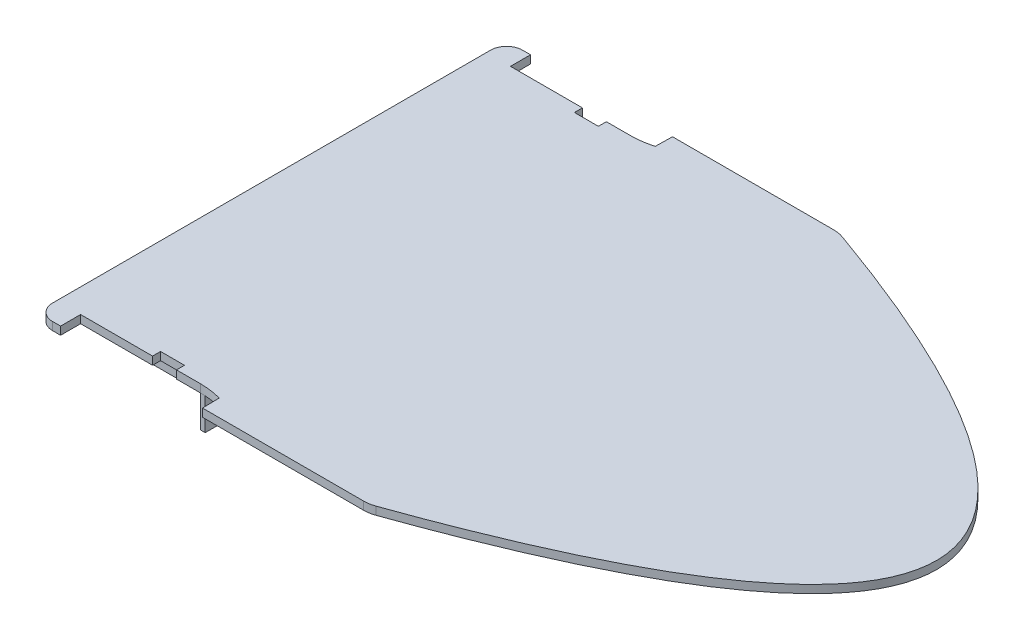
from build123d import *

# Parameters (mm, degrees)
CROQUIS1_W                 = 416
CROQUIS1_H                 = 294
SALIENTE_EXTRUIR1_DEPTH    = 5
CORTAR_EXTRUIR1_DEPTH      = 255.750858684
REDONDEO1_R                = 10
SALIENTE_EXTRUIR3_DEPTH    = 20
REDONDEO2_R                = 5
REDONDEO2_OF_SIMETR_A3_R   = 5
CORTAR_EXTRUIR5_DEPTH      = 256.925770488
CORTAR_EXTRUIR5_DEPTH_BACK = 256.925770488
REDONDEO4_R                = 20
ESCALA1_START              = -20
ESCALA1_DEPTH              = 17.828103166
ESCALA1_START_2            = -2.171896834
ESCALA1_2_DEPTH            = 10
ESCALA1_START_3            = -42.171896834
ESCALA1_3_DEPTH            = 40
CROQUIS9_W                 = 50
CROQUIS9_H                 = 50
SALIENTE_EXTRUIR4_DEPTH    = 2
REDONDEO5_R                = 5
CROQUIS10_R                = 2
CORTAR_EXTRUIR7_DEPTH      = 2
CROQUIS11_R                = 20
SALIENTE_EXTRUIR5_DEPTH    = 3
CROQUIS12_R                = 16
CORTAR_EXTRUIR8_DEPTH      = 3
CROQUIS13_R                = 20
SALIENTE_EXTRUIR6_DEPTH    = 2
CROQUIS14_R                = 18
CORTAR_EXTRUIR9_DEPTH      = 2


# Read off the part's stored shape, not the designer's step: Escala1
with BuildPart() as part:
    # Croquis1 → Saliente-Extruir1 (new body)
    with BuildSketch(Plane(origin=(0, 0, 0), x_dir=(1, 0, 0), z_dir=(0, 1, 0))):
        Rectangle(CROQUIS1_W, CROQUIS1_H)
    extrude(amount=SALIENTE_EXTRUIR1_DEPTH)

    # Croquis3 → Cortar-Extruir1 (cut, through all)
    with BuildSketch(Plane(origin=(0, 5, 0), x_dir=(1, 0, 0), z_dir=(0, 1, 0))):
        with BuildLine():
            Line((-193, 154.47), (-193, 134.47))
            Line((-193, 134.47), (-148, 134.47))
            Line((-148, 134.47), (-148, 129.47))
            Line((-148, 129.47), (-133, 129.47))
            Line((-133, 129.47), (-133, 134.47))
            Line((-133, 134.47), (-118, 134.47))
            ThreePointArc((-118, 134.47), (-111.127739024, 134.944531511), (-104.385922224, 136.359118837))
            Line((-104.385922224, 136.359118837), (-104, 156.355395091))
            Line((-104, 156.355395091), (-193, 156.355395091))
            Line((-193, 156.355395091), (-193, 154.47))
        make_face()
    cortar_extruir1 = extrude(amount=-CORTAR_EXTRUIR1_DEPTH, mode=Mode.SUBTRACT)

    # Simetría1: Cortar-Extruir1 across plane
    add(cortar_extruir1.mirror(Plane.XY), mode=Mode.SUBTRACT)

    # Redondeo1
    redondeo1_edges = [part.edges().sort_by_distance(p)[0] for p in [
        (-208, 2.5, -147),
        (208, 2.5, -147),
        (208, 2.5, 147),
        (-208, 2.5, 147),
    ]]
    fillet(redondeo1_edges, radius=REDONDEO1_R)

    # Croquis5 → Saliente-Extruir3 (add)
    with BuildSketch(Plane.XZ):
        Polygon((-208, 110.96), (-115, 110.96), (-115, 134.560081146), (-118, 134.47), (-118, 113.96), (-208, 113.96), align=None)
    saliente_extruir3 = extrude(amount=SALIENTE_EXTRUIR3_DEPTH)

    # Redondeo2
    redondeo2_edges = [part.edges().sort_by_distance(p)[0] for p in [
        (-115, -10, 110.96),
    ]]
    fillet(redondeo2_edges, radius=REDONDEO2_R)

    # Simetría3: Saliente-Extruir3 across plane
    add(saliente_extruir3.mirror(Plane.XY))

    # Redondeo2 of Simetría3
    redondeo2_of_simetr_a3_edges = [part.edges().sort_by_distance(p)[0] for p in [
        (-115, -10, -110.96),
    ]]
    fillet(redondeo2_of_simetr_a3_edges, radius=REDONDEO2_OF_SIMETR_A3_R)

    # Croquis7 → Cortar-Extruir5 (cut, two sides: drawn at the far end of the back side and taken through both)
    with BuildSketch(Plane(origin=(0, 5, 0), x_dir=(1, 0, 0), z_dir=(0, 1, 0)).offset(-CORTAR_EXTRUIR5_DEPTH_BACK)):
        with BuildLine():
            Line((198, 147), (0, 147))
            add(Edge.make_bspline(
                [(0, 147), (208, 73.5), (208, 0)],
                knots=[0, 0, 0, 0.5, 0.5, 0.5], degree=2))
            Line((208, 0), (208, 137))
            ThreePointArc((208, 137), (205.071067812, 144.071067812), (198, 147))
        make_face()
        with BuildLine():
            Line((208, -137), (208, 0))
            add(Edge.make_bspline(
                [(208, 0), (208, -73.5), (0, -147)],
                knots=[0.5, 0.5, 0.5, 1, 1, 1], degree=2))
            Line((0, -147), (198, -147))
            ThreePointArc((198, -147), (205.071067812, -144.071067812), (208, -137))
        make_face()
    extrude(amount=CORTAR_EXTRUIR5_DEPTH + CORTAR_EXTRUIR5_DEPTH_BACK, mode=Mode.SUBTRACT)

    # Redondeo4
    redondeo4_edges = [part.edges().sort_by_distance(p)[0] for p in [
        (0, 2.5, -147),
        (0, 2.5, 147),
    ]]
    fillet(redondeo4_edges, radius=REDONDEO4_R)

    # Escala1 outline → Escala1 (cut)
    with BuildSketch(Plane(origin=(0, 0, 0), x_dir=(1, 0, 0), z_dir=(0, 1, 0)).offset(ESCALA1_START)):
        with BuildLine():
            Line((-115, 115.96), (-115, 134.560081146))
            Line((-115, 134.560081146), (-118, 134.47))
            Line((-118, 134.47), (-118, 113.96))
            Line((-118, 113.96), (-208, 113.96))
            Line((-208, 113.96), (-208, 110.96))
            Line((-208, 110.96), (-120, 110.96))
            ThreePointArc((-120, 110.96), (-116.464466094, 112.424466094), (-115, 115.96))
        make_face()
        with BuildLine():
            Line((-118, -134.47), (-115, -134.560081146))
            Line((-115, -134.560081146), (-115, -115.96))
            ThreePointArc((-115, -115.96), (-116.464466094, -112.424466094), (-120, -110.96))
            Line((-120, -110.96), (-208, -110.96))
            Line((-208, -110.96), (-208, -113.96))
            Line((-208, -113.96), (-118, -113.96))
            Line((-118, -113.96), (-118, -134.47))
        make_face()
    extrude(amount=ESCALA1_DEPTH, mode=Mode.SUBTRACT)

    # Escala1 2 outline → Escala1 2 (add)
    with BuildSketch(Plane(origin=(0, 0, 0), x_dir=(1, 0, 0), z_dir=(0, 1, 0)).offset(ESCALA1_START_2)):
        with BuildLine():
            add(Edge.make_bspline(
                [(36.105170669, 291.681097591), (855.032944113, -0.000122107), (36.105170669, -291.681341805)],
                knots=[0.003943504, 0.003943504, 0.003943504, 0.996056496, 0.996056496, 0.996056496], degree=2))
            ThreePointArc((36.105170669, 291.681097591), (29.49404346, 293.415920236), (22.684079728, 293.999877893))
            Line((22.684079728, 293.999877893), (-178.792055331, 293.999877893))
            Line((-178.792055331, 293.999877893), (-179.202787056, 272.718115567))
            ThreePointArc((-179.202787056, 272.718115567), (-192.686420657, 269.888940914), (-206.430942609, 268.939877893))
            Line((-206.430942609, 268.939877893), (-236.430942609, 268.939877893))
            Line((-236.430942609, 268.939877893), (-236.430942609, 258.939877893))
            Line((-236.430942609, 258.939877893), (-266.430942609, 258.939877893))
            Line((-266.430942609, 258.939877893), (-266.430942609, 268.939877893))
            Line((-266.430942609, 268.939877893), (-356.430942609, 268.939877893))
            Line((-356.430942609, 268.939877893), (-356.430942609, 293.999877893))
            Line((-356.430942609, 293.999877893), (-366.430942609, 293.999877893))
            ThreePointArc((-366.430942609, 293.999877893), (-380.573078233, 288.142013517), (-386.430942609, 273.999877893))
            Line((-386.430942609, 273.999877893), (-386.430942609, -274.000122107))
            ThreePointArc((-386.430942609, -274.000122107), (-380.573078233, -288.142257731), (-366.430942609, -294.000122107))
            Line((-366.430942609, -294.000122107), (-356.430942609, -294.000122107))
            Line((-356.430942609, -294.000122107), (-356.430942609, -268.940122107))
            Line((-356.430942609, -268.940122107), (-266.430942609, -268.940122107))
            Line((-266.430942609, -268.940122107), (-266.430942609, -258.940122107))
            Line((-266.430942609, -258.940122107), (-236.430942609, -258.940122107))
            Line((-236.430942609, -258.940122107), (-236.430942609, -268.940122107))
            Line((-236.430942609, -268.940122107), (-206.430942609, -268.940122107))
            ThreePointArc((-206.430942609, -268.940122107), (-192.686420657, -269.889185129), (-179.202787056, -272.718359781))
            Line((-179.202787056, -272.718359781), (-178.792055331, -294.000122107))
            Line((-178.792055331, -294.000122107), (22.684079728, -294.000122107))
            ThreePointArc((22.684079728, -294.000122107), (29.49404346, -293.41616445), (36.105170669, -291.681341805))
        make_face()
    extrude(amount=ESCALA1_2_DEPTH)

    # Escala1 3 outline → Escala1 3 (add)
    with BuildSketch(Plane(origin=(0, 0, 0), x_dir=(1, 0, 0), z_dir=(0, 1, 0)).offset(ESCALA1_START_3)):
        with BuildLine():
            Line((-200.430942609, 231.919877893), (-200.430942609, 269.120040185))
            Line((-200.430942609, 269.120040185), (-206.430942609, 268.939877893))
            Line((-206.430942609, 268.939877893), (-206.430942609, 227.919877893))
            Line((-206.430942609, 227.919877893), (-386.430942609, 227.919877893))
            Line((-386.430942609, 227.919877893), (-386.430942609, 221.919877893))
            Line((-386.430942609, 221.919877893), (-210.430942609, 221.919877893))
            ThreePointArc((-210.430942609, 221.919877893), (-203.359874797, 224.848810081), (-200.430942609, 231.919877893))
        make_face()
        with BuildLine():
            Line((-206.430942609, -268.940122107), (-200.430942609, -269.120284399))
            Line((-200.430942609, -269.120284399), (-200.430942609, -231.920122107))
            ThreePointArc((-200.430942609, -231.920122107), (-203.359874797, -224.849054295), (-210.430942609, -221.920122107))
            Line((-210.430942609, -221.920122107), (-386.430942609, -221.920122107))
            Line((-386.430942609, -221.920122107), (-386.430942609, -227.920122107))
            Line((-386.430942609, -227.920122107), (-206.430942609, -227.920122107))
            Line((-206.430942609, -227.920122107), (-206.430942609, -268.940122107))
        make_face()
    extrude(amount=ESCALA1_3_DEPTH)

    # Croquis9 → Saliente-Extruir4 (add)
    with BuildSketch(Plane.XZ.offset(2.171896834)):
        with Locations((250, 0)):
            Rectangle(CROQUIS9_W, CROQUIS9_H)
    extrude(amount=SALIENTE_EXTRUIR4_DEPTH)

    # Redondeo5
    redondeo5_edges = [part.edges().sort_by_distance(p)[0] for p in [
        (275, -3.171896834, -25),
        (275, -3.171896834, 25),
        (225, -3.171896834, 25),
        (225, -3.171896834, -25),
    ]]
    fillet(redondeo5_edges, radius=REDONDEO5_R)

    # Croquis10 → Cortar-Extruir7 (cut)
    with BuildSketch(Plane.XZ.offset(4.171896834)):
        with Locations(Location((230, 20, 0), (0, 0, 270))):
            Circle(CROQUIS10_R)
        with Locations(Location((270, 20, 0), (0, 0, 270))):
            Circle(CROQUIS10_R)
    cortar_extruir7 = extrude(amount=-CORTAR_EXTRUIR7_DEPTH, mode=Mode.SUBTRACT)

    # Simetría7: Cortar-Extruir7 across plane
    add(cortar_extruir7.mirror(Plane.XY), mode=Mode.SUBTRACT)

    # Croquis11 → Saliente-Extruir5 (add)
    with BuildSketch(Plane.XZ.offset(4.171896834)):
        with Locations(Location((250, 0, 0), (0, 0, 270))):
            Circle(CROQUIS11_R)
    extrude(amount=SALIENTE_EXTRUIR5_DEPTH)

    # Croquis12 → Cortar-Extruir8 (cut)
    with BuildSketch(Plane.XZ.offset(7.171896834)):
        with Locations(Location((250, 0, 0), (0, 0, 270))):
            Circle(CROQUIS12_R)
    extrude(amount=-CORTAR_EXTRUIR8_DEPTH, mode=Mode.SUBTRACT)

    # Croquis13 → Saliente-Extruir6 (add)
    with BuildSketch(Plane.XZ.offset(4.171896834)):
        with Locations(Location((250, 0, 0), (0, 0, 270))):
            Circle(CROQUIS13_R)
    extrude(amount=SALIENTE_EXTRUIR6_DEPTH)

    # Croquis14 → Cortar-Extruir9 (cut)
    with BuildSketch(Plane.XZ.offset(6.171896834)):
        with Locations(Location((250, 0, 0), (0, 0, 270))):
            Circle(CROQUIS14_R)
    extrude(amount=-CORTAR_EXTRUIR9_DEPTH, mode=Mode.SUBTRACT)


solid = part.part
